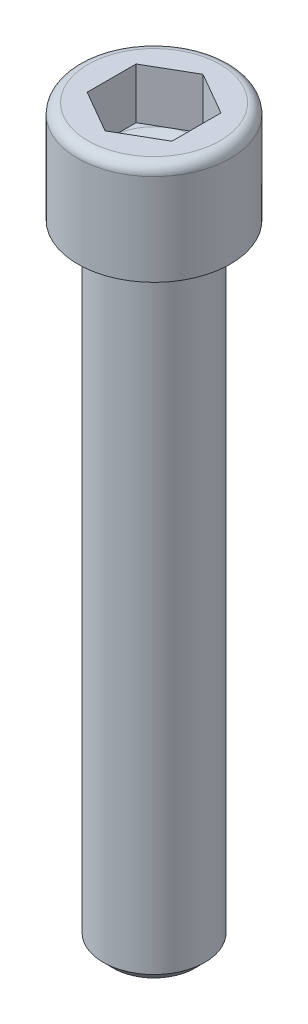
from build123d import *
from build123d.topology import SkipClean

# Parameters (mm, degrees)
CUT_EXTRUDE1_DEPTH = 6


# Read off the part's stored shape, not the designer's step: Move Face1
with BuildPart() as part:
    # Sketch1 → Revolve1 (revolve)
    with BuildSketch(Plane(origin=(0, 0, 0), x_dir=(0, 0, -1), z_dir=(1, 0, 0)), mode=Mode.PRIVATE) as revolve1_sk:
        with BuildLine():
            Line((0, 78.118365096), (-5, 79))
            Line((-5, 79), (-5, 85))
            Line((-5, 85), (-7.8, 85))
            ThreePointArc((-7.8, 85), (-8.648528137, 84.648528137), (-9, 83.8))
            Line((-9, 83.8), (-9, 73))
            Line((-9, 73), (-6, 73))
            Line((-6, 73), (-6, 1.2))
            Line((-6, 1.2), (-4.8, 0))
            Line((-4.8, 0), (0, 0))
            Line((0, 0), (0, 78.118365096))
        make_face()
    revolve(revolve1_sk.sketch.rotate(Axis((0, 0, 0), (0, 1, 0)), 180), axis=Axis((0, 0, 0), (0, 1, 0)))

    # Sketch2 → Cut-Extrude1 (cut)
    with BuildSketch(Plane(origin=(0, 85, 0), x_dir=(1, 0, 0), z_dir=(0, 1, 0))):
        Polygon((0, 5.773502692), (-5, 2.886751346), (-5, -2.886751346), (0, -5.773502692), (5, -2.886751346), (5, 2.886751346), align=None)
    extrude(amount=-CUT_EXTRUDE1_DEPTH, mode=Mode.SUBTRACT)

    # Move Face1 outline → Move Face1 (revolve)
    with SkipClean():  # the faces are left unmerged after this step: merging them gives an invalid solid
        with BuildSketch(Plane.XY):
            Polygon((0, -1), (4.8, -1), (6, 0.2), (6, 1.2), (4.8, 0), (0, 0), align=None)
        revolve(axis=Axis((0, 0, 0), (0, 1, 0)))
    add(part.part.scale(1), mode=Mode.REPLACE)  # the faces are merged on a copy


solid = part.part
